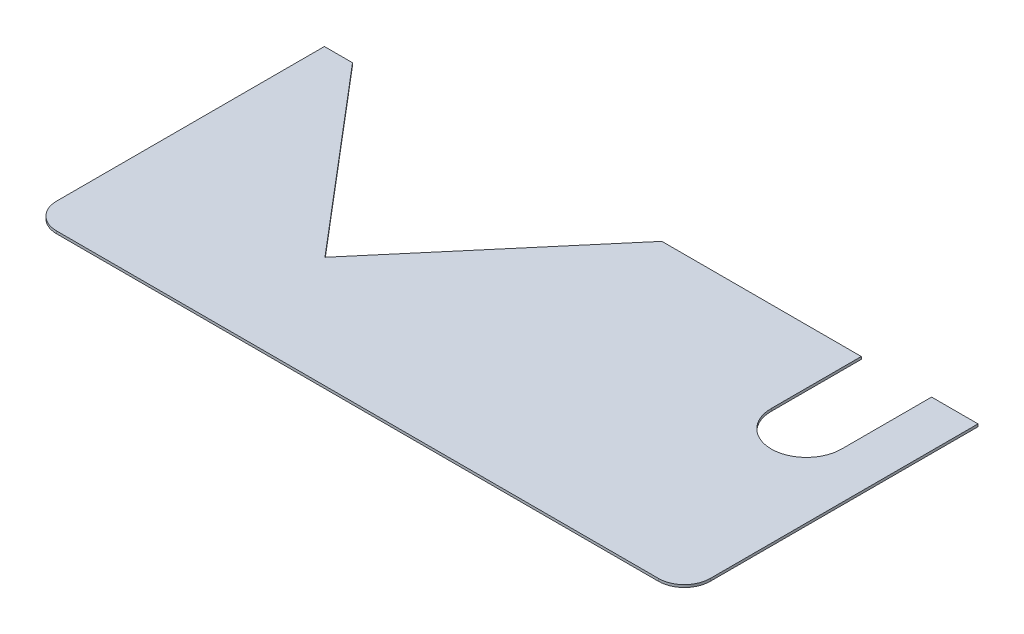
from build123d import *

# Parameters (mm, degrees)
SKETCH1_W          = 104.4
SKETCH1_H          = 0.9
BASE_FLANGE1_DEPTH = 116.2
FILLET1_R          = 9.2
CUT_EXTRUDE1_DEPTH = 128.389520762
CUT_EXTRUDE2_DEPTH = 128.389520762


# Sheet-metal steps are written as plain solids
with BuildPart() as part:
    # Sketch1 → Base-Flange1 (new, symmetric)
    with BuildSketch(Plane(origin=(0, 0, 0), x_dir=(0, 0, -1), z_dir=(1, 0, 0))):
        with Locations((0, -0.45)):
            Rectangle(SKETCH1_W, SKETCH1_H)
    extrude(amount=BASE_FLANGE1_DEPTH, both=True)

    # Fillet1
    fillet1_edges = [part.edges().sort_by_distance(p)[0] for p in [
        (116.2, -0.45, 52.2),
        (-116.2, -0.45, 52.2),
    ]]
    fillet(fillet1_edges, radius=FILLET1_R)

    # Sketch2 → Cut-Extrude1 (cut, through all)
    with BuildSketch(Plane(origin=(0, 0, 0), x_dir=(1, 0, 0), z_dir=(0, 1, 0))):
        with BuildLine():
            Line((74.7, 52.2), (99.7, 52.2))
            Line((99.7, 52.2), (99.7, 20.2))
            ThreePointArc((99.7, 20.2), (87.2, 7.7), (74.7, 20.2))
            Line((74.7, 20.2), (74.7, 52.2))
        make_face()
    extrude(amount=-CUT_EXTRUDE1_DEPTH, mode=Mode.SUBTRACT)

    # Sketch3 → Cut-Extrude2 (cut, through all)
    with BuildSketch(Plane(origin=(0, 0, 0), x_dir=(1, 0, 0), z_dir=(0, 1, 0))):
        Polygon((-106.2, 52.2), (-51.2, -12.607406984), (3.8, 52.2), align=None)
    extrude(amount=-CUT_EXTRUDE2_DEPTH, mode=Mode.SUBTRACT)


solid = part.part
